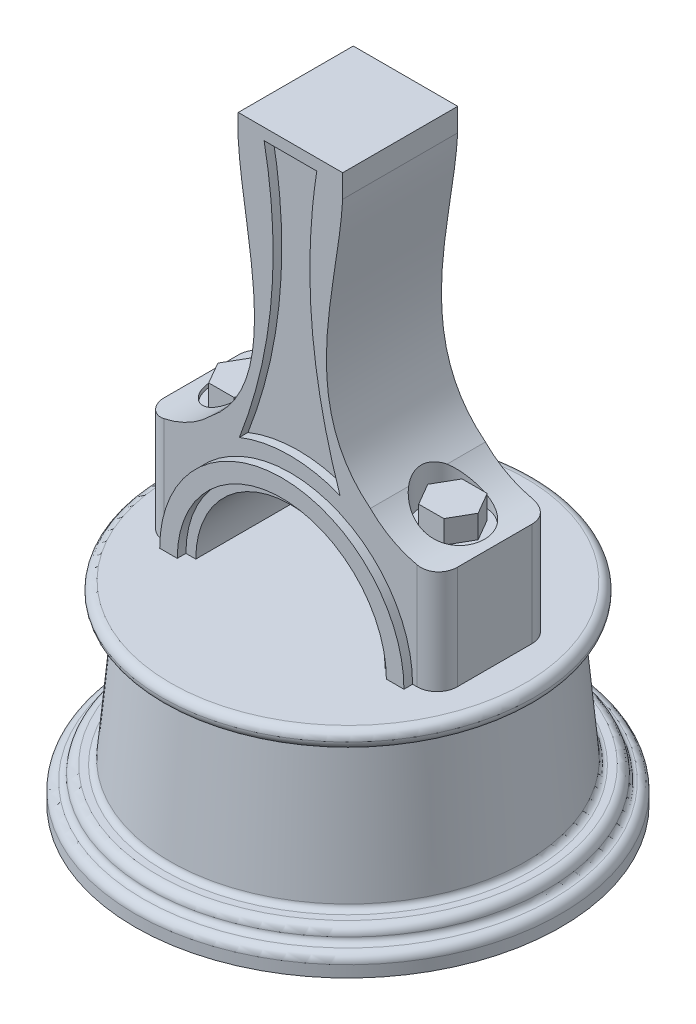
from build123d import *
from build123d.topology import SkipClean

# Parameters (mm, degrees)
SKETCH4_R                = 164.321017561
BOSS_EXTRUDE1_DEPTH      = 14.986
FILLET2_R                = 7.62
FILLET3_R                = 7.62
CUT_EXTRUDE1_DEPTH       = 293.37
CUT_EXTRUDE1_DEPTH_BACK  = 364.998
SKETCH5_W                = 518.073680805
SKETCH5_H                = 61.893758326
CUT_EXTRUDE3_DEPTH       = 203.2
CUT_EXTRUDE3_DEPTH_BACK  = 323.342
SKETCH9_W                = 416.570842546
SKETCH9_H                = 115.149663793
CUT_EXTRUDE4_DEPTH       = 265.684
CUT_EXTRUDE4_DEPTH_BACK  = 314.452
SKETCH10_W               = 357.2970731
SKETCH10_H               = 56.159317183
SKETCH11_R               = 175.797651342
BOSS_EXTRUDE5_DEPTH      = 12.192
FILLET4_R                = 7.62
FILLET5_R                = 5.08
SKETCH12_R               = 188.080921631
BOSS_EXTRUDE6_DEPTH      = 17.78
FILLET6_R                = 7.62
FILLET7_R                = 5.08
BOSS_EXTRUDE7_DEPTH      = 50.8
BOSS_EXTRUDE7_DEPTH_BACK = 50.8
CUT_EXTRUDE5_DEPTH       = 152.4
CUT_EXTRUDE7_DEPTH       = 152.4
BOSS_EXTRUDE8_DEPTH      = 7.62
CUT_EXTRUDE8_DEPTH       = 7.62
SKETCH19_R               = 27.94
CUT_EXTRUDE9_DEPTH       = 271.78
BOSS_EXTRUDE9_DEPTH      = 20.32
FILLET8_R                = 17.78


with BuildPart() as part:
    # Sketch3 → Revolve1 (revolve)
    with BuildSketch(Plane.XY, mode=Mode.PRIVATE) as revolve1_sk:
        Polygon((0, 202.565626223), (0, 0), (164.321017561, 0), (145.978001078, 202.565626223), align=None)
    revolve(revolve1_sk.sketch.rotate(Axis((0, 202.565626223, 0), (0, -1, 0)), 90), axis=Axis((0, 202.565626223, 0), (0, -1, 0)))

    # Sketch4 → Boss-Extrude1 (add)
    with BuildSketch(Plane(origin=(0, 202.565626223, 0), x_dir=(1, 0, 0), z_dir=(0, 1, 0))):
        with Locations(Location((0, 0, 0), (0, 0, 270))):
            Circle(SKETCH4_R)
    extrude(amount=BOSS_EXTRUDE1_DEPTH)

    # Fillet2
    fillet2_edges = [part.edges().sort_by_distance(p)[0] for p in [
        (0, 202.565626223, -145.978001078),
        (0, 202.565626223, -164.321017561),
    ]]
    fillet(fillet2_edges, radius=FILLET2_R)

    # Fillet3
    # the kernel refuses this fillet: 7.62 mm, written as the material it takes off along each edge
    with BuildSketch(Plane(origin=(0, 217.551626223, 0), x_dir=(0, 0, 1), z_dir=(-1, 0, 0))) as fillet3_piece_1:
        with BuildLine():
            CenterArc((156.705252071, -7.62), FILLET3_R, 1.910213172, 88.089786828)
            Line((156.705252071, 0), (156.705252071, 0.1524))
            Line((156.705252071, 0.1524), (164.321017561, 0.1524))
            Line((164.321017561, 0.1524), (164.473417561, 0))
            ThreePointArc((164.473417561, 0), (164.473417561, -3.683), (164.47333287, -7.36092))
            Line((164.47333287, -7.36092), (164.321017561, -7.366))
        make_face()
    revolve(axis=Axis((0, 217.551626223, 0), (0, 1, 0)), mode=Mode.SUBTRACT)

    # Sketch5 → Cut-Extrude1 (cut, two sides: drawn at the far end of the back side and taken through both)
    with BuildSketch(Plane.XY.offset(-CUT_EXTRUDE1_DEPTH_BACK)):
        with Locations((-6.112963785, -11.191101175)):
            Rectangle(SKETCH5_W, SKETCH5_H)
    extrude(amount=CUT_EXTRUDE1_DEPTH + CUT_EXTRUDE1_DEPTH_BACK, mode=Mode.SUBTRACT)

    # Sketch9 → Cut-Extrude3 (cut, two sides: drawn at the far end of the back side and taken through both)
    with BuildSketch(Plane.XY.offset(-CUT_EXTRUDE3_DEPTH_BACK)):
        with Locations((4.402781263, 6.552117647)):
            Rectangle(SKETCH9_W, SKETCH9_H)
    extrude(amount=CUT_EXTRUDE3_DEPTH + CUT_EXTRUDE3_DEPTH_BACK, mode=Mode.SUBTRACT)

    # Sketch10 → Cut-Extrude4 (cut, two sides: drawn at the far end of the back side and taken through both)
    with BuildSketch(Plane.XY.offset(-CUT_EXTRUDE4_DEPTH_BACK)):
        with Locations((3.537594783, 48.419624174)):
            Rectangle(SKETCH10_W, SKETCH10_H)
    extrude(amount=CUT_EXTRUDE4_DEPTH + CUT_EXTRUDE4_DEPTH_BACK, mode=Mode.SUBTRACT)

    # Sketch11 → Boss-Extrude5 (add)
    with BuildSketch(Plane.XZ.offset(-76.499282765)):
        with Locations(Location((0, 0, 0), (0, 0, 270))):
            Circle(SKETCH11_R)
    extrude(amount=BOSS_EXTRUDE5_DEPTH)

    # Fillet4
    fillet4_edges = [part.edges().sort_by_distance(p)[0] for p in [
        (0, 76.499282765, 175.797651342),
    ]]
    fillet(fillet4_edges, radius=FILLET4_R)

    # Fillet5
    fillet5_edges = [part.edges().sort_by_distance(p)[0] for p in [
        (0, 76.499282765, -157.393743517),
    ]]
    fillet(fillet5_edges, radius=FILLET5_R)

    # Sketch12 → Boss-Extrude6 (add)
    with BuildSketch(Plane.XZ.offset(-64.307282765)):
        with Locations(Location((0, 0, 0), (0, 0, 90))):
            Circle(SKETCH12_R)
    extrude(amount=BOSS_EXTRUDE6_DEPTH)

    # Fillet6
    fillet6_edges = [part.edges().sort_by_distance(p)[0] for p in [
        (0, 64.307282765, -188.080921631),
    ]]
    fillet(fillet6_edges, radius=FILLET6_R)

    # Fillet7
    # the kernel refuses this fillet: 5.08 mm, written as the material it adds along each edge
    with BuildSketch(Plane(origin=(0, 64.307282765, 0), x_dir=(0, 0, -1), z_dir=(-1, 0, 0))) as fillet7_piece_1:
        with BuildLine():
            CenterArc((180.867746514, -5.073482324), FILLET7_R, 91.835695834, 85.901288996)
            Line((175.791708445, -4.872889395), (175.284104639, -4.852830102))
            ThreePointArc((175.284104639, -4.852830102), (175.289651342, -4.572), (175.289651342, 0))
            Line((175.289651342, 0), (175.797651342, 0.508))
            ThreePointArc((175.797651342, 0.508), (180.460921631, 0.508), (180.688743566, 0.511649898))
            Line((180.688743566, 0.511649898), (180.705016561, 0.003910605))
        make_face()
    revolve(axis=Axis((0, 64.307282765, 0), (0, -1, 0)))

    # Sketch13 → Boss-Extrude7 (add, two sides: drawn at the far end of the back side and taken through both)
    with SkipClean():  # the faces are left unmerged after this step: merging them gives an invalid solid
        with BuildSketch(Plane.XY.offset(-BOSS_EXTRUDE7_DEPTH_BACK)):
            with BuildLine():
                Line((-129.527252071, 217.551626223), (-129.527252071, 308.991626223))
                ThreePointArc((-129.527252071, 308.991626223), (-70.548706673, 333.421339616), (-46.11899328, 392.399885013))
                Line((-46.11899328, 392.399885013), (-46.11899328, 577.917136616))
                Line((-46.11899328, 577.917136616), (46.11899328, 577.917136616))
                Line((46.11899328, 577.917136616), (46.11899328, 392.399885013))
                ThreePointArc((46.11899328, 392.399885013), (70.548706673, 333.421339616), (129.527252071, 308.991626223))
                Line((129.527252071, 308.991626223), (129.527252071, 217.551626223))
                Line((129.527252071, 217.551626223), (-129.527252071, 217.551626223))
            make_face()
        extrude(amount=BOSS_EXTRUDE7_DEPTH + BOSS_EXTRUDE7_DEPTH_BACK)

    # Sketch14 → Cut-Extrude5 (cut)
    with SkipClean():  # the faces are left unmerged after this step: merging them gives an invalid solid
        with BuildSketch(Plane.XY.offset(50.8)):
            with BuildLine():
                Line((-83.605725686, 217.551626223), (83.605725686, 217.551626223))
                ThreePointArc((83.605725686, 217.551626223), (0, 301.157351909), (-83.605725686, 217.551626223))
            make_face()
        extrude(amount=-CUT_EXTRUDE5_DEPTH, mode=Mode.SUBTRACT)

    # Sketch15 → Cut-Extrude7 (cut)
    with SkipClean():  # the faces are left unmerged after this step: merging them gives an invalid solid
        with BuildSketch(Plane.XY.offset(50.8)):
            with BuildLine():
                Line((-46.11899328, 577.917136616), (-98.36214643, 577.917136616))
                Line((-98.36214643, 577.917136616), (-70.548706673, 333.421339616))
                add(Edge.make_bspline(
                    [(-46.11899328, 577.917136616), (-50.901805556, 507.403039432), (2.496749097, 391.437753678), (-70.548706673, 333.421339616)],
                    knots=[0, 0, 0, 0, 1, 1, 1, 1], degree=3))
            make_face()
        cut_extrude7 = extrude(amount=-CUT_EXTRUDE7_DEPTH, mode=Mode.SUBTRACT)

    # Mirror3: Cut-Extrude7 across plane
    with SkipClean():  # the faces are left unmerged after this step: merging them gives an invalid solid
        add(cut_extrude7.mirror(Plane(origin=(0, 0, 0), x_dir=(0, 0, 1), z_dir=(1, 0, 0))), mode=Mode.SUBTRACT)

    # Sketch16 → Boss-Extrude8 (add)
    with SkipClean():  # the faces are left unmerged after this step: merging them gives an invalid solid
        with BuildSketch(Plane.XY.offset(50.8)):
            with BuildLine():
                Line((-92.330882192, 217.551626223), (-107.83621715, 217.551626223))
                ThreePointArc((-107.83621715, 217.551626223), (0, 325.387843373), (107.83621715, 217.551626223))
                Line((107.83621715, 217.551626223), (92.330882192, 217.551626223))
                ThreePointArc((92.330882192, 217.551626223), (0, 309.882508415), (-92.330882192, 217.551626223))
            make_face()
        boss_extrude8 = extrude(amount=BOSS_EXTRUDE8_DEPTH)

    # Mirror4: Boss-Extrude8 across plane
    with SkipClean():  # the faces are left unmerged after this step: merging them gives an invalid solid
        add(boss_extrude8.mirror(Plane.XY))

    # Sketch17 → Cut-Extrude8 (cut)
    with SkipClean():  # the faces are left unmerged after this step: merging them gives an invalid solid
        with BuildSketch(Plane.XY.offset(50.8)):
            with BuildLine():
                Line((-23.25899328, 567.771486767), (23.25899328, 567.771486767))
                add(Edge.make_bspline(
                    [(43.762737549, 329.861517955), (4.303483733, 447.229222708), (23.25899328, 567.771486767)],
                    knots=[0, 0, 0, 1, 1, 1], degree=2))
                ThreePointArc((43.762737549, 329.861517955), (-0.674190735, 338.40472639), (-45.111119018, 329.861517955))
                add(Edge.make_bspline(
                    [(-45.111119018, 329.861517955), (0.095038205, 446.788509156), (-23.25899328, 567.771486767)],
                    knots=[0, 0, 0, 1, 1, 1], degree=2))
            make_face()
        cut_extrude8 = extrude(amount=-CUT_EXTRUDE8_DEPTH, mode=Mode.SUBTRACT)

    # Mirror5: Cut-Extrude8 across plane
    with SkipClean():  # the faces are left unmerged after this step: merging them gives an invalid solid
        add(cut_extrude8.mirror(Plane.XY), mode=Mode.SUBTRACT)

    # Sketch19 → Cut-Extrude9 (cut)
    with SkipClean():  # the faces are left unmerged after this step: merging them gives an invalid solid
        with BuildSketch(Plane(origin=(0, 577.917136616, 0), x_dir=(1, 0, 0), z_dir=(0, 1, 0))):
            with Locations(Location((-92.697252071, 0, 0), (0, 0, 270))):
                Circle(SKETCH19_R)
            with Locations(Location((92.697252071, 0, 0), (0, 0, 270))):
                Circle(SKETCH19_R)
        extrude(amount=-CUT_EXTRUDE9_DEPTH, mode=Mode.SUBTRACT)

    # Sketch20 → Boss-Extrude9 (add)
    with SkipClean():  # the faces are left unmerged after this step: merging them gives an invalid solid
        with BuildSketch(Plane(origin=(0, 306.137136616, 0), x_dir=(1, 0, 0), z_dir=(0, 1, 0))):
            Polygon((-114.874205528, 0), (-103.785728799, -19.205805073), (-81.608775342, -19.205805073), (-70.520298613, 0), (-81.608775342, 19.205805073), (-103.785728799, 19.205805073), align=None)
            Polygon((70.520430482, -0.07647803), (81.675073193, -19.243929886), (103.851894782, -19.167451856), (114.874073659, 0.07647803), (103.719430948, 19.243929886), (81.54260936, 19.167451856), align=None)
        extrude(amount=BOSS_EXTRUDE9_DEPTH)

    # Fillet8
    fillet8_edges = [part.edges().sort_by_distance(p)[0] for p in [
        (129.527252071, 263.271626223, -50.8),
        (-129.527252071, 263.271626223, -50.8),
        (129.527252071, 263.271626223, 50.8),
        (-129.527252071, 263.271626223, 50.8),
    ]]
    fillet(fillet8_edges, radius=FILLET8_R)


solid = part.part
